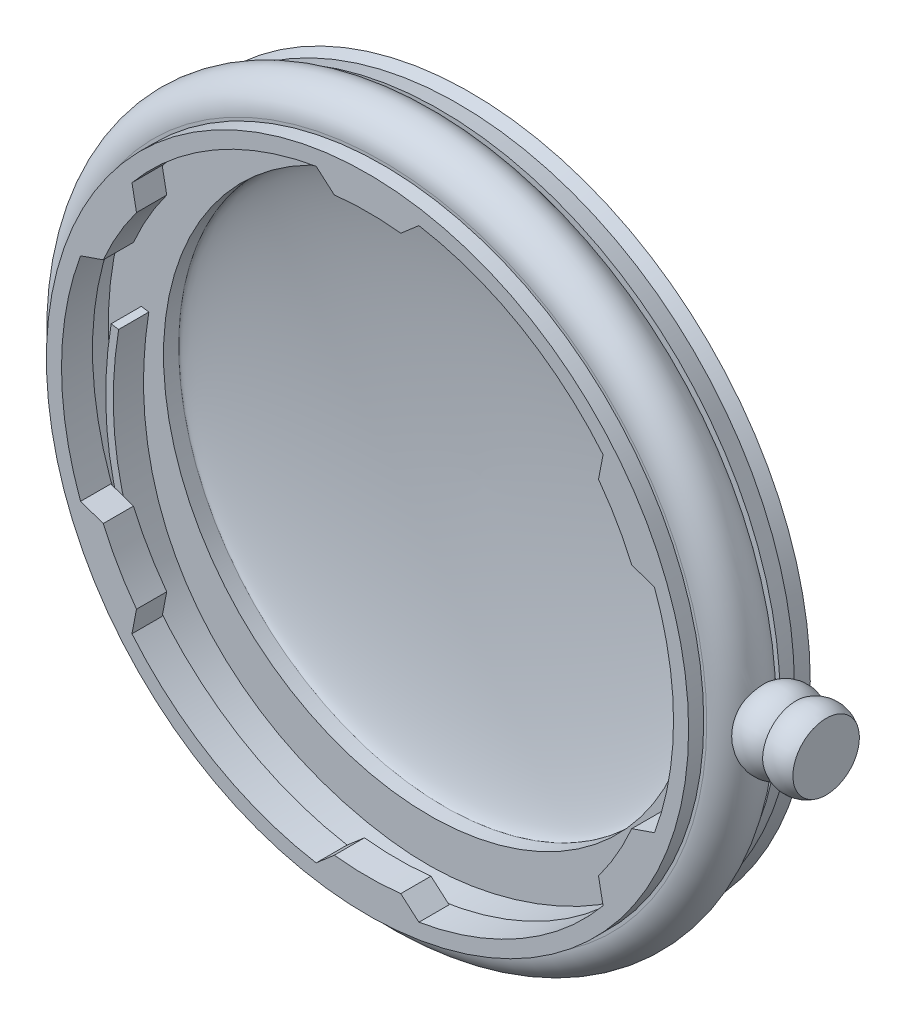
from build123d import *

# Parameters (mm, degrees)
EXTRUDE_1_DEPTH    = 2
EXTRUDE_1916_DEPTH = 2
EXTRUDE_2093_DEPTH = 2


# Read off the part's stored shape, not the designer's step: пружина
with BuildPart() as part:
    # Эскиз3 → Повернуть1 (revolve)
    with BuildSketch(Plane(origin=(0, 0, 0), x_dir=(1, 0, 0), z_dir=(0, 1, 0))):
        with BuildLine():
            Line((20.25, 0), (21.25, 0))
            Line((21.25, 0), (21.25, 1))
            Line((21.25, 1), (21.450000000000003, 1))
            ThreePointArc((21.450000000000003, 1), (23.35, 2.9), (21.450000000000003, 4.8))
            Line((21.450000000000003, 4.8), (22.5, 4.8))
            Line((22.5, 4.8), (22.249999999999996, 5.999999999999999))
            Line((22.249999999999996, 5.999999999999999), (22.5, 6.8))
            ThreePointArc((22.5, 6.8), (11.37242576618493, 9.260806168487733), (0, 10))
            Line((0, 10), (0, 7.5))
            add(Edge.make_bspline(
                [(17.6, 5.1), (17.68648321597052, 5.583837835157827), (11.760671311595946, 7.409355669392823), (0, 7.5)],
                knots=[0, 0, 0, 0, 1, 1, 1, 1], degree=3))
            Line((17.6, 5.1), (17.6, 4.099999999999999))
            Line((17.6, 4.099999999999999), (20.25, 4.099999999999999))
            Line((20.25, 4.099999999999999), (21.25, 4.099999999999999))
            Line((21.25, 4.099999999999999), (21.25, 2.0499999999999994))
            Line((21.25, 2.0499999999999994), (20.25, 2.0499999999999994))
            Line((20.25, 2.0499999999999994), (20.25, 0))
        make_face()
    revolve(axis=Axis((0, 0, 0), (0, 0, -1)))

    # Эскиз4 → Повернуть2 (revolve)
    with BuildSketch(Plane(origin=(0, 0, 0), x_dir=(0, 0, -1), z_dir=(0, 1, 0)), mode=Mode.PRIVATE) as revolve_2_sk:
        with BuildLine():
            Line((0.8000000000000034, -27.35), (3.0000000000000036, -27.35))
            Line((3.0000000000000036, -27.35), (3.0000000000000036, -22.729544095990384))
            Line((3.0000000000000036, -22.729544095990384), (1.4954477914950397, -22.729544095990384))
            ThreePointArc((1.4954477914950397, -22.729544095990384), (1.1072583055705365, -22.994415552653194), (0.8000000000000034, -23.35))
            ThreePointArc((0.8000000000000034, -23.35), (0.5000000000000051, -24.350000000000005), (0.8000000000000034, -25.350000000000005))
            ThreePointArc((0.8000000000000034, -25.350000000000005), (0.5000000000000056, -26.350000000000005), (0.8000000000000034, -27.35))
        make_face()
    revolve(revolve_2_sk.sketch.rotate(Axis((27.35, 0, -3.0000000000000036), (-1, 0, 0)), 180), axis=Axis((27.35, 0, -3.0000000000000036), (-1, 0, 0)))

    # Эскиз6 → Бобышка-Вытянуть1 (add)
    with BuildSketch(Plane.XY):
        with BuildLine():
            Line((-2.2, -18.922539470166264), (-3.4, -19.962527395097045))
            ThreePointArc((-3.4, -19.962527395097045), (1.24e-15, -20.25), (3.4, -19.962527395097045))
            Line((3.4, -19.962527395097045), (2.2, -18.922539470166264))
            ThreePointArc((2.2, -18.922539470166264), (1.17e-15, -19.050000000000004), (-2.2, -18.922539470166264))
        make_face()
        with BuildLine():
            Line((-15.28739988527774, -11.366525623408865), (-15.588055847896868, -12.925750070415583))
            ThreePointArc((-15.588055847896868, -12.925750070415583), (-17.537014426634908, -10.124999999999963), (-18.988055847896852, -7.036777324681391))
            Line((-18.988055847896852, -7.036777324681391), (-17.487399885277735, -7.556013846757328))
            ThreePointArc((-17.487399885277735, -7.556013846757328), (-16.497783942093584, -9.524999999999965), (-15.28739988527774, -11.366525623408865))
        make_face()
        with BuildLine():
            Line((-17.487399885277693, 7.556013846757449), (-18.988055847896817, 7.036777324681521))
            ThreePointArc((-18.988055847896817, 7.036777324681521), (-17.53701442663485, 10.125000000000083), (-15.588055847896788, 12.925750070415688))
            Line((-15.588055847896788, 12.925750070415688), (-15.287399885277672, 11.36652562340897))
            ThreePointArc((-15.287399885277672, 11.36652562340897), (-16.497783942093523, 9.525000000000087), (-17.487399885277693, 7.556013846757449))
        make_face()
        with BuildLine():
            Line((-2.1999999999998687, 18.922539470166274), (-3.3999999999998614, 19.96252739509707))
            ThreePointArc((-3.3999999999998614, 19.96252739509707), (1.4063e-13, 20.25), (3.400000000000138, 19.962527395097023))
            Line((3.400000000000138, 19.962527395097023), (2.2000000000001316, 18.92253947016625))
            ThreePointArc((2.2000000000001316, 18.92253947016625), (1.3229e-13, 19.05), (-2.1999999999998687, 18.922539470166274))
        make_face()
        with BuildLine():
            Line((15.287399885277813, 11.366525623408753), (15.58805584789695, 12.925750070415468))
            ThreePointArc((15.58805584789695, 12.925750070415468), (17.53701442663497, 10.124999999999838), (18.988055847896895, 7.036777324681256))
            Line((18.988055847896895, 7.036777324681256), (17.487399885277778, 7.556013846757204))
            ThreePointArc((17.487399885277778, 7.556013846757204), (16.49778394209364, 9.52499999999985), (15.287399885277813, 11.366525623408753))
        make_face()
        with BuildLine():
            Line((17.487399885277625, -7.55601384675757), (18.988055847896756, -7.036777324681652))
            ThreePointArc((18.988055847896756, -7.036777324681652), (17.53701442663477, -10.125000000000204), (15.588055847896687, -12.925750070415797))
            Line((15.588055847896687, -12.925750070415797), (15.287399885277582, -11.366525623409075))
            ThreePointArc((15.287399885277582, -11.366525623409075), (16.497783942093445, -9.52500000000019), (17.487399885277625, -7.55601384675757))
        make_face()
    extrude(amount=-EXTRUDE_1_DEPTH)


with BuildPart() as body_2:
    # Extrude 1916 outline → Extrude 1916 (new body)
    with BuildSketch(Plane.XY.offset(-4.099999999999999)):
        with BuildLine():
            Line((-18.571936423, 1.971918763), (-19.065403762, 2.052479209))
            add(Edge.make_bspline(
                [(-19.065403762, 2.052479209), (-19.5608168488982, -0.982138754343008), (-19.5289875725156, -3.74715756678371), (-18.5829798934297, -8.70402014463167), (-17.66817405116, -10.8950314599481), (-15.1452997626881, -14.657462235248), (-13.5381887525688, -16.2283170155345), (-9.83508618174294, -18.721900143671), (-7.73935639577415, -19.6452755858668), (-4.93491023286923, -20.3856470306141), (-4.36475543627115, -20.5130328985695), (-3.20883686791784, -20.7261834053054), (-2.62317028558831, -20.8129043899692), (-0.821806580127364, -20.9956157365632), (0.436839580527144, -21.0126468689093), (2.47738891240008, -20.8022281628961), (3.18550462308289, -20.6921642905461), (4.64481731746651, -20.3864905165527), (5.39466991149929, -20.1912898588091), (7.67052292630654, -19.4738461288268), (9.22297257444626, -18.8198657154798), (12.2107189598901, -17.1319774941594), (13.6461529796486, -16.0979257899178), (16.2053537619806, -13.6189879292943), (17.3290438798867, -12.1735499646399), (19.0598614969327, -8.84838748586538), (19.666072598016, -6.96885118670048), (20.161387122414, -2.77158072536785), (20.0508287060798, -0.454865816939449), (19.491983625, 2.084957609)],
                knots=[0, 0, 0, 0, 0.125, 0.125, 0.25, 0.25, 0.375, 0.375, 0.5, 0.5, 0.53125, 0.53125, 0.5625, 0.5625, 0.625000000000001, 0.625000000000001, 0.656250000000001, 0.656250000000001, 0.687500000000001, 0.687500000000001, 0.750000000000001, 0.750000000000001, 0.8125, 0.8125, 0.875, 0.875, 0.9375, 0.9375, 1, 1, 1, 1], degree=3))
            Line((19.491983625, 2.084957609), (19.003664778, 1.977511327))
            add(Edge.make_bspline(
                [(-18.571936423, 1.971918763), (-20.6643253902591, -10.8448624589785), (-11.7567916507723, -19.9473001190712), (7.22272099149138, -20.9638051634758), (22.1874596075476, -12.4921099734157), (19.003664778, 1.977511327)],
                knots=[0, 0, 0, 0, 0.536963763998546, 0.636963763998546, 1, 1, 1, 1], degree=3))
        make_face()
    extrude(amount=EXTRUDE_1916_DEPTH)

    # Эскиз8 → Extrude 2093 (add)
    with BuildSketch(Plane.XY.offset(-2.0999999999999988)):
        with BuildLine():
            add(Edge.make_bspline(
                [(19.00366477765303, 1.977511326728632), (19.526518131814505, -0.025310238768522), (19.52564554450298, -1.9997204689170207)],
                knots=[0, 0, 0, 1, 1, 1], degree=2))
            add(Edge.make_bspline(
                [(19.52564554450298, -1.9997204689170207), (17.898847867822333, -0.5761912037183654), (17.400431062203204, 0.6084296537456167), (19.00366477765303, 1.977511326728632)],
                knots=[0, 0, 0, 0, 1, 1, 1, 1], degree=3))
        make_face()
    extrude(amount=-EXTRUDE_2093_DEPTH)


solid = Compound([part.part, body_2.part])
